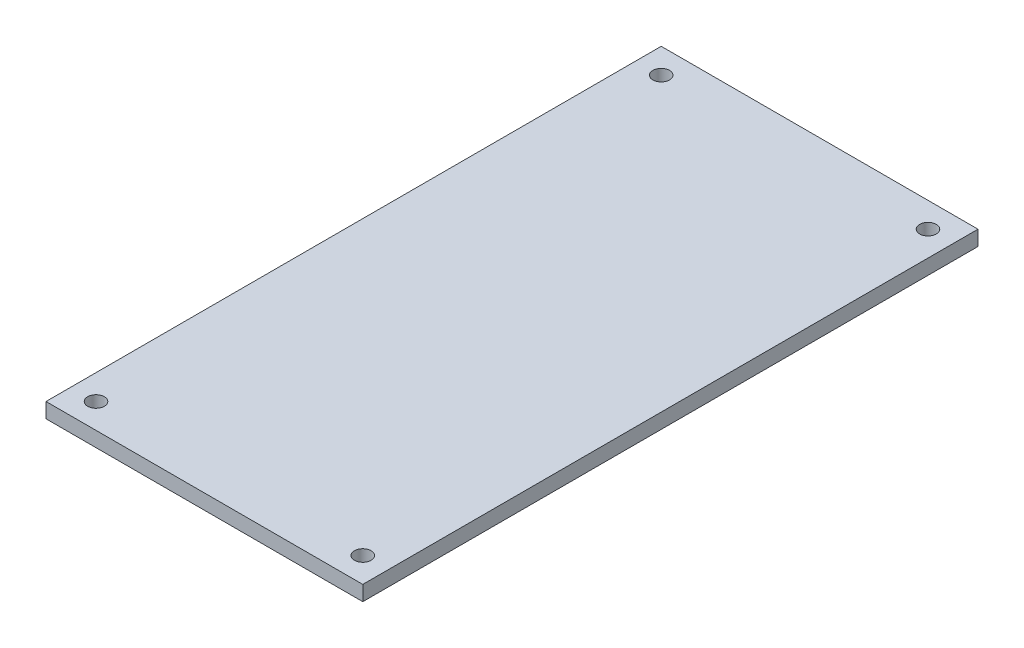
from build123d import *

# Parameters (mm, degrees)
SKETCH1_W           = 38
SKETCH1_H           = 73.8
BOSS_EXTRUDE1_DEPTH = 1.8
SKETCH2_R           = 1
CUT_EXTRUDE1_DEPTH  = 42.543350852


with BuildPart() as part:
    # Sketch1 → Boss-Extrude1 (new body)
    with BuildSketch(Plane(origin=(0, 0, 0), x_dir=(1, 0, 0), z_dir=(0, 1, 0))):
        Rectangle(SKETCH1_W, SKETCH1_H)
    extrude(amount=BOSS_EXTRUDE1_DEPTH)

    # Sketch2 → Cut-Extrude1 (cut, through all)
    with BuildSketch(Plane(origin=(0, 1.8, 0), x_dir=(1, 0, 0), z_dir=(0, 1, 0))):
        with Locations((-16, 33.9)):
            Circle(SKETCH2_R)
        with Locations((16, 33.9)):
            Circle(SKETCH2_R)
    cut_extrude1 = extrude(amount=-CUT_EXTRUDE1_DEPTH, mode=Mode.SUBTRACT)

    # Mirror1: Cut-Extrude1 across plane
    add(cut_extrude1.mirror(Plane.XY), mode=Mode.SUBTRACT)


solid = part.part
